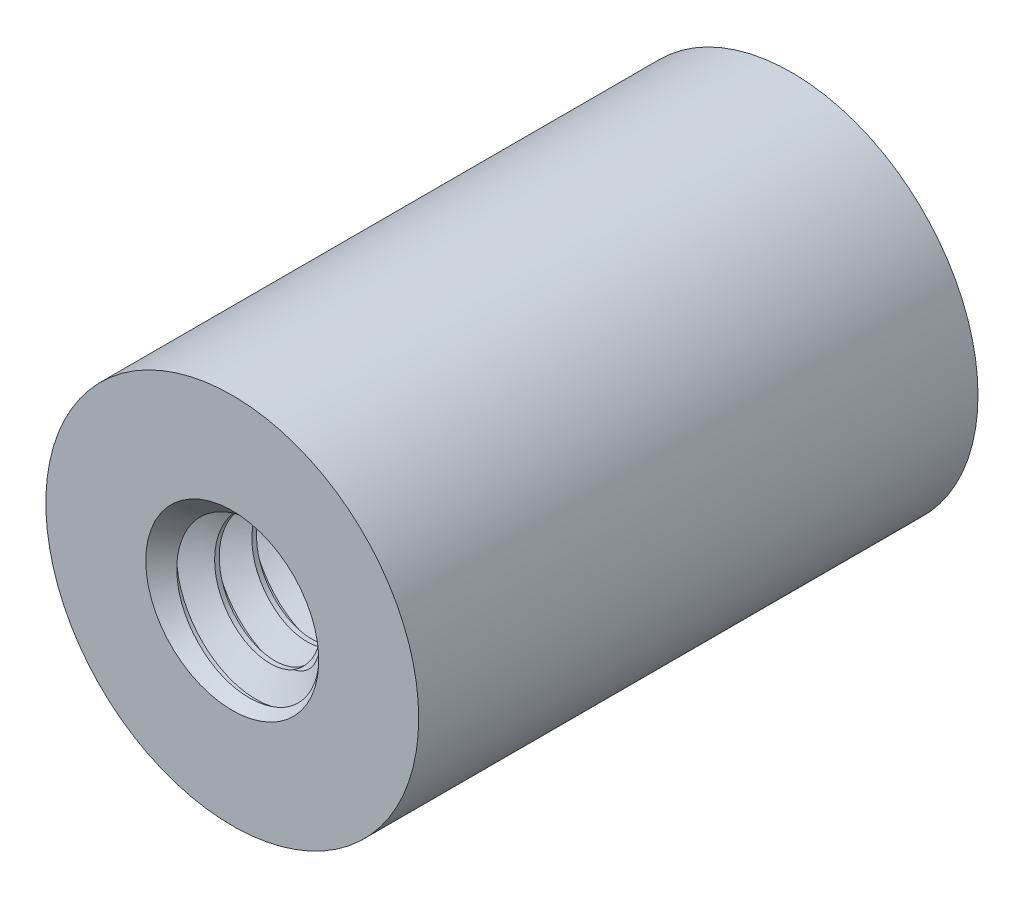
from build123d import *

# Parameters (mm, degrees)
EXTRUDE1_DEPTH      = 4.7625
EXTRUDE1_DEPTH_BACK = 4.7625
SKETCH1_R           = 3.175
SKETCH1_R_2         = 1.4224
SWEEP1_PITCH        = 0.635
SKETCH6_R           = 3.175
EXTRUDE2_DEPTH      = 12.108121932


with BuildPart() as part:
    # Sketch1 → Extrude1 (new, two sides: drawn at the far end of the back side and taken through both)
    with BuildSketch(Plane.XY.offset(-EXTRUDE1_DEPTH_BACK)):
        Circle(SKETCH1_R)
        Circle(SKETCH1_R_2, mode=Mode.SUBTRACT)
    extrude(amount=EXTRUDE1_DEPTH + EXTRUDE1_DEPTH_BACK)

    # Sweep1: the profile of Sketch12 profile screwed along a right-hand helix of 16 turns, 6 arcs to a turn; built about Z, then put on its axis
    sweep1_z = Axis((0, 0, 0), (0, 0, 1))
    sweep1_corners = [(1.4227, 0, -0.555798205), (1.4227, 0, 0.000173205), (1.009955401, 0, -0.238125), (1.009955401, 0, -0.3175)]
    with BuildLine(mode=Mode.PRIVATE) as sweep1_profile:
        Line(sweep1_corners[0], sweep1_corners[1])
        Line(sweep1_corners[1], sweep1_corners[2])
        Line(sweep1_corners[2], sweep1_corners[3])
        Line(sweep1_corners[3], sweep1_corners[0])
    sweep1_cap = Face(sweep1_profile.wire())
    sweep1_turn_angles = [0, 30, 60, 90, 120, 150, 180, 210, 240, 270, 300, 330, 360]
    sweep1_turn_weights = [1, 0.8660254037844387, 1, 0.8660254037844387, 1, 0.8660254037844387, 1, 0.8660254037844387, 1, 0.8660254037844387, 1, 0.8660254037844387, 1]
    sweep1_turn_rails = [Edge.make_bspline([Vector(p[0], p[1], 0).rotate(sweep1_z, sweep1_turn_angles[k]) / sweep1_turn_weights[k] + Vector(0, 0, p[2] + SWEEP1_PITCH * sweep1_turn_angles[k] / 360) for k in range(13)], [0, 0, 0, 1, 1, 2, 2, 3, 3, 4, 4, 5, 5, 6, 6, 6], 2, sweep1_turn_weights) for p in sweep1_corners]
    sweep1_turn_sides = [Face.make_surface_from_curves(sweep1_turn_rails[p[0]], sweep1_turn_rails[p[1]]) for p in [(0, 1), (1, 2), (2, 3), (3, 0)]]
    sweep1 = Plane(origin=(0, 0, -4.7625), x_dir=(0, 1, 0), z_dir=(0, 0, 1)) * Solid(Shell([*[p.moved(Location((0, 0, SWEEP1_PITCH * i))) for i in range(16) for p in sweep1_turn_sides], sweep1_cap, sweep1_cap.rotate(sweep1_z, 5760).moved(Location((0, 0, SWEEP1_PITCH * 5760 / 360)))]))
    add(sweep1)

    # Sketch6 → Extrude2 (cut, through all)
    with BuildSketch(Plane(origin=(0, 0, -4.7625), x_dir=(-1, 0, 0), z_dir=(0, 0, -1))):
        with Locations(Location((0, 0, 0), (0, 0, 180))):
            Circle(SKETCH6_R)
    extrude2 = extrude(amount=EXTRUDE2_DEPTH, mode=Mode.SUBTRACT)

    # Extrude3 cone 1 section (through the dimple's axis) → Extrude3 (revolve, cut)
    with BuildSketch(Plane(origin=(0, 0, -4.7625), x_dir=(0, 1, 0), z_dir=(1, 0, 0))):
        Polygon((0, 0), (1.4732, 0), (0, 1.579813584), align=None)
    extrude3 = revolve(axis=Axis((0, 0, -4.7625), (0, 0, 1)), mode=Mode.SUBTRACT)

    # Mirror1: Extrude2, Extrude3 across plane
    add(extrude2.mirror(Plane.XY), mode=Mode.SUBTRACT)
    add(extrude3.mirror(Plane.XY), mode=Mode.SUBTRACT)


solid = part.part
